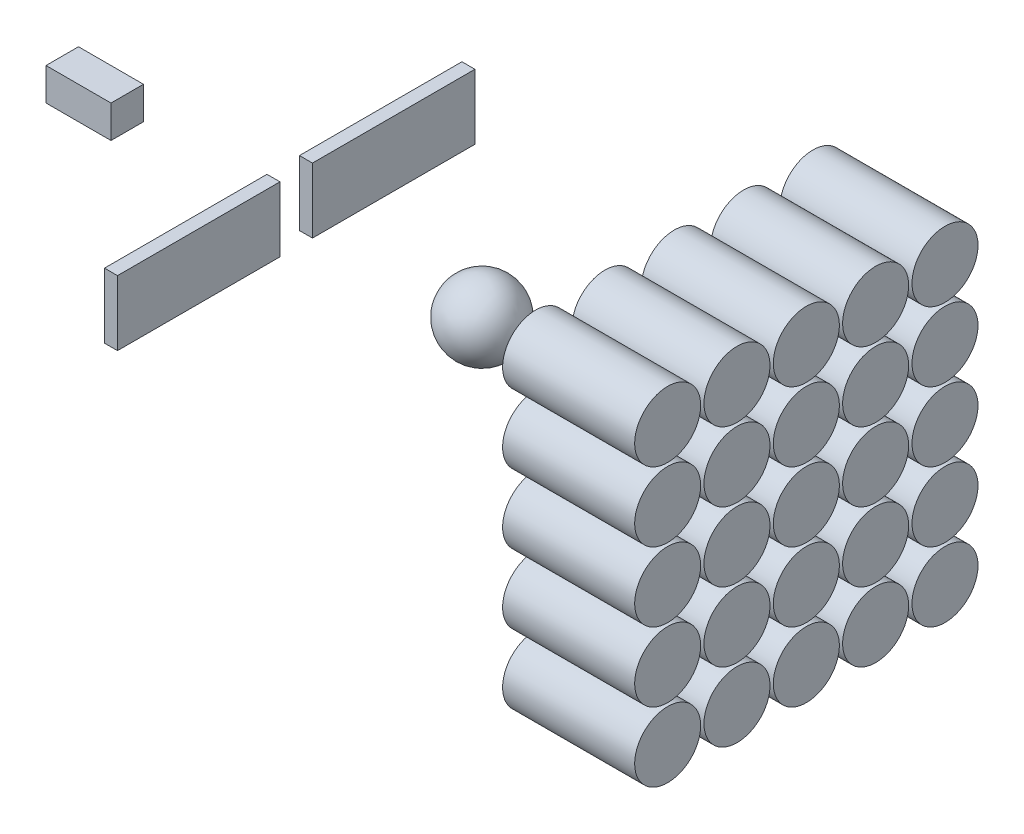
from build123d import *

# Parameters (mm, degrees)
SKETCH2_W             = 100
SKETCH2_H             = 50
BOSS_EXTRUDE2_DEPTH   = 25
SKETCH3_W             = 203.2
SKETCH3_H             = 50.8
SKETCH4_W             = 20
SKETCH4_H             = 250
BOSS_EXTRUDE3_DEPTH   = 50
BOSS_EXTRUDE3_2_DEPTH = 50
LPATTERN1_START       = 591.7
LPATTERN1_OUTLINE_R   = 50.8
LPATTERN1_DEPTH       = 203.2


# Read off the part's stored shape, not the designer's step: LPattern1
with BuildPart() as part:
    # Sketch2 → Boss-Extrude2 (new, symmetric)
    with BuildSketch(Plane.XY):
        with Locations((-300, 0)):
            Rectangle(SKETCH2_W, SKETCH2_H)
    extrude(amount=BOSS_EXTRUDE2_DEPTH, both=True)


with BuildPart() as body_2:
    # Sketch3 → Revolve1 (revolve)
    with BuildSketch(Plane(origin=(0, 0, 0), x_dir=(1, 0, 0), z_dir=(0, 1, 0))):
        with BuildLine():
            Line((240, 0), (351.7, 0))
            ThreePointArc((351.7, 0), (295.85, 55.85), (240, 0))
        make_face()
        with Locations((693.3, 25.4)):
            Rectangle(SKETCH3_W, SKETCH3_H)
    revolve(axis=Axis((0, 0, 0), (1, 0, 0)))


with BuildPart() as body_3:
    # Sketch4 → Boss-Extrude3 (new, symmetric)
    with BuildSketch(Plane(origin=(0, 0, 0), x_dir=(1, 0, 0), z_dir=(0, 1, 0))):
        with Locations((0, 150)):
            Rectangle(SKETCH4_W, SKETCH4_H)
    extrude(amount=BOSS_EXTRUDE3_DEPTH, both=True)


with BuildPart() as body_4:
    # Sketch4 → Boss-Extrude3 2 (new, symmetric)
    with BuildSketch(Plane(origin=(0, 0, 0), x_dir=(1, 0, 0), z_dir=(0, 1, 0))):
        with Locations((0, -150)):
            Rectangle(SKETCH4_W, SKETCH4_H)
    extrude(amount=BOSS_EXTRUDE3_2_DEPTH, both=True)


with BuildPart() as body_5:
    # LPattern1 outline → LPattern1 (new body)
    with BuildSketch(Plane.YZ.offset(LPATTERN1_START)):
        with Locations((213.36, 213.36)):
            Circle(LPATTERN1_OUTLINE_R)
        with Locations((213.36, 106.68)):
            Circle(LPATTERN1_OUTLINE_R)
        with Locations((213.36, 0)):
            Circle(LPATTERN1_OUTLINE_R)
        with Locations((106.68, 213.36)):
            Circle(LPATTERN1_OUTLINE_R)
        with Locations((106.68, 106.68)):
            Circle(LPATTERN1_OUTLINE_R)
        with Locations((106.68, 0)):
            Circle(LPATTERN1_OUTLINE_R)
        with Locations((0, 213.36)):
            Circle(LPATTERN1_OUTLINE_R)
        with Locations((0, 106.68)):
            Circle(LPATTERN1_OUTLINE_R)
    extrude(amount=LPATTERN1_DEPTH)

    # Mirror1: body 5 across plane


with BuildPart() as body_5_1:
    add(body_5.part)
    add(body_5.part.mirror(Plane.XY))

    # Mirror2: body 5 across plane


with BuildPart() as body_5_2:
    add(body_5_1.part)
    add(body_5_1.part.mirror(Plane.ZX))


solid = Compound([part.part, body_2.part, body_3.part, body_4.part, body_5_2.part])
